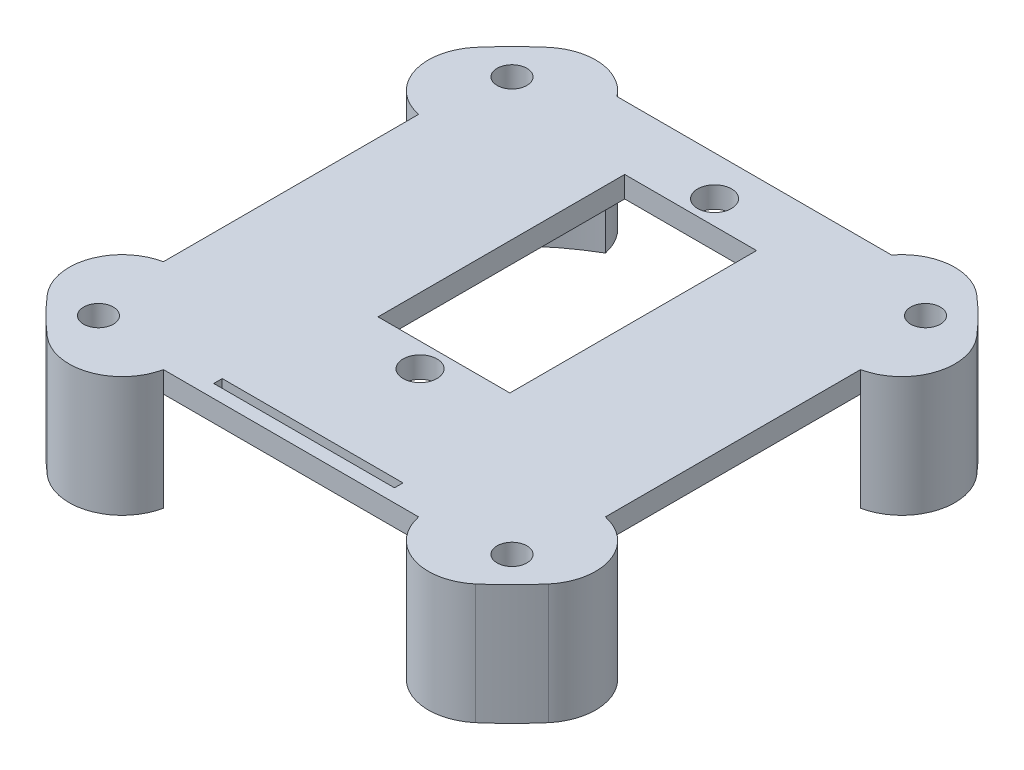
from build123d import *

# Parameters (mm, degrees)
SKETCH3_R            = 31
SKETCH3_R_2          = 1.6
SERVO_MOUNT_DEPTH    = 2
SKETCH4_R            = 31
SKETCH4_R_2          = 24
SPACER_DEPTH         = 9.3
FLEX_CABLE_REACH     = 47.274
SKETCH5_W            = 17
SKETCH5_H            = 0.8
SKETCH7_W            = 24
SKETCH7_H            = 62
CUT_EXTRUDE3_DEPTH   = 45.816180114
SKETCH8_W            = 62
SKETCH8_H            = 24
CUT_EXTRUDE4_DEPTH   = 45.816180114
MOUNTING_HOLES_REACH = 47.274
SKETCH10_R           = 1.4
CUT_EXTRUDE5_REACH   = 46.816
FILLET2_R            = 5


with BuildPart() as part:
    # Sketch3 → Servo mount (new body)
    with BuildSketch(Plane(origin=(0, 0, 0), x_dir=(1, 0, 0), z_dir=(0, 1, 0))):
        with Locations(Location((0, 0, 0), (0, 0, 270))):
            Circle(SKETCH3_R)
        with Locations(Location((0, -8.65, 0), (0, 0, 270))):
            Circle(SKETCH3_R_2, mode=Mode.SUBTRACT)
        with Locations(Location((0, 19.05, 0), (0, 0, 270))):
            Circle(SKETCH3_R_2, mode=Mode.SUBTRACT)
        Polygon((-6.2, 16.1), (-6.2, 2.227105745), (-6.2, -6.4), (-5.7, -6.4), (5.7, -6.4), (6.2, -6.4), (6.2, 2.227105745), (6.2, 16.1), (6.2, 16.8), (5.7, 16.8), (-5.7, 16.8), (-6.2, 16.8), align=None, mode=Mode.SUBTRACT)
    extrude(amount=-SERVO_MOUNT_DEPTH)

    # Sketch4 → Spacer (add)
    with BuildSketch(Plane(origin=(0, -2, 0), x_dir=(-1, 0, 0), z_dir=(0, -1, 0))):
        with Locations(Location((0, 0, 0), (0, 0, 270))):
            Circle(SKETCH4_R)
        with Locations(Location((0, 0, 0), (0, 0, 270))):
            Circle(SKETCH4_R_2, mode=Mode.SUBTRACT)
    extrude(amount=SPACER_DEPTH)

    # Sketch5 → Flex cable (cut, up to next)
    with BuildSketch(Plane(origin=(0, 0, 0), x_dir=(1, 0, 0), z_dir=(0, 1, 0)), mode=Mode.PRIVATE) as flex_cable_sk1:
        with Locations((0, -19.15054858)):
            Rectangle(SKETCH5_W, SKETCH5_H)
    flex_cable_tool1 = extrude(flex_cable_sk1.sketch, amount=-FLEX_CABLE_REACH, mode=Mode.PRIVATE) & part.part
    add(flex_cable_tool1.solids().sort_by_distance((0, 0, 19.150549))[0], mode=Mode.SUBTRACT)

    # Sketch7 → Cut-Extrude3 (cut, through all)
    with BuildSketch(Plane.XZ.offset(2)):
        Rectangle(SKETCH7_W, SKETCH7_H)
    extrude(amount=CUT_EXTRUDE3_DEPTH, mode=Mode.SUBTRACT)

    # Sketch8 → Cut-Extrude4 (cut, through all)
    with BuildSketch(Plane.XZ.offset(2)):
        Rectangle(SKETCH8_W, SKETCH8_H)
    extrude(amount=CUT_EXTRUDE4_DEPTH, mode=Mode.SUBTRACT)

    # Sketch10 → Mounting holes (cut, up to next)
    with BuildSketch(Plane.XZ.offset(11.3), mode=Mode.PRIVATE) as mounting_holes_sk1:
        with Locations(Location((-19.445436483, -19.445436483, 0), (0, 0, 270))):
            Circle(SKETCH10_R)
    mounting_holes_tool1 = extrude(mounting_holes_sk1.sketch, amount=-MOUNTING_HOLES_REACH, mode=Mode.PRIVATE) & part.part
    # Sketch10 → Mounting holes (cut, up to next)
    with BuildSketch(Plane.XZ.offset(11.3), mode=Mode.PRIVATE) as mounting_holes_sk2:
        with Locations(Location((19.445436483, -19.445436483, 0), (0, 0, 270))):
            Circle(SKETCH10_R)
    mounting_holes_tool2 = extrude(mounting_holes_sk2.sketch, amount=-MOUNTING_HOLES_REACH, mode=Mode.PRIVATE) & part.part
    # Sketch10 → Mounting holes (cut, up to next)
    with BuildSketch(Plane.XZ.offset(11.3), mode=Mode.PRIVATE) as mounting_holes_sk3:
        with Locations(Location((-19.445436483, 19.445436483, 0), (0, 0, 270))):
            Circle(SKETCH10_R)
    mounting_holes_tool3 = extrude(mounting_holes_sk3.sketch, amount=-MOUNTING_HOLES_REACH, mode=Mode.PRIVATE) & part.part
    # Sketch10 → Mounting holes (cut, up to next)
    with BuildSketch(Plane.XZ.offset(11.3), mode=Mode.PRIVATE) as mounting_holes_sk4:
        with Locations(Location((19.445436483, 19.445436483, 0), (0, 0, 270))):
            Circle(SKETCH10_R)
    mounting_holes_tool4 = extrude(mounting_holes_sk4.sketch, amount=-MOUNTING_HOLES_REACH, mode=Mode.PRIVATE) & part.part
    add(mounting_holes_tool1.solids().sort_by_distance((-19.445436, -11.3, -19.445436))[0], mode=Mode.SUBTRACT)
    add(mounting_holes_tool2.solids().sort_by_distance((19.445436, -11.3, -19.445436))[0], mode=Mode.SUBTRACT)
    add(mounting_holes_tool3.solids().sort_by_distance((-19.445436, -11.3, 19.445436))[0], mode=Mode.SUBTRACT)
    add(mounting_holes_tool4.solids().sort_by_distance((19.445436, -11.3, 19.445436))[0], mode=Mode.SUBTRACT)

    # Sketch11 → Cut-Extrude5 (cut, up to next)
    with BuildSketch(Plane.XZ.offset(2), mode=Mode.PRIVATE) as cut_extrude5_sk1:
        with BuildLine():
            Line((-12, -22.784609691), (12, -22.784609691))
            Line((12, -22.784609691), (12, -28.583211856))
            ThreePointArc((12, -28.583211856), (0, -31), (-12, -28.583211856))
            Line((-12, -28.583211856), (-12, -22.784609691))
        make_face()
    cut_extrude5_tool1 = extrude(cut_extrude5_sk1.sketch, amount=-CUT_EXTRUDE5_REACH, mode=Mode.PRIVATE) & part.part
    # Sketch11 → Cut-Extrude5 (cut, up to next)
    with BuildSketch(Plane.XZ.offset(2), mode=Mode.PRIVATE) as cut_extrude5_sk2:
        with BuildLine():
            Line((28.583211856, 12), (20.784609691, 12))
            Line((20.784609691, 12), (20.784609691, -12))
            Line((20.784609691, -12), (28.583211856, -12))
            ThreePointArc((28.583211856, -12), (31, 0), (28.583211856, 12))
        make_face()
    cut_extrude5_tool2 = extrude(cut_extrude5_sk2.sketch, amount=-CUT_EXTRUDE5_REACH, mode=Mode.PRIVATE) & part.part
    # Sketch11 → Cut-Extrude5 (cut, up to next)
    with BuildSketch(Plane.XZ.offset(2), mode=Mode.PRIVATE) as cut_extrude5_sk3:
        with BuildLine():
            Line((-28.583211856, -12), (-20.784609691, -12))
            Line((-20.784609691, -12), (-20.784609691, 12))
            Line((-20.784609691, 12), (-28.583211856, 12))
            ThreePointArc((-28.583211856, 12), (-31, 0), (-28.583211856, -12))
        make_face()
    cut_extrude5_tool3 = extrude(cut_extrude5_sk3.sketch, amount=-CUT_EXTRUDE5_REACH, mode=Mode.PRIVATE) & part.part
    # Sketch11 → Cut-Extrude5 (cut, up to next)
    with BuildSketch(Plane.XZ.offset(2), mode=Mode.PRIVATE) as cut_extrude5_sk4:
        with BuildLine():
            Line((12, 20.784609691), (12, 28.583211856))
            ThreePointArc((12, 28.583211856), (0, 31), (-12, 28.583211856))
            Line((-12, 28.583211856), (-12, 20.784609691))
            Line((-12, 20.784609691), (12, 20.784609691))
        make_face()
    cut_extrude5_tool4 = extrude(cut_extrude5_sk4.sketch, amount=-CUT_EXTRUDE5_REACH, mode=Mode.PRIVATE) & part.part
    add(cut_extrude5_tool1.solids().sort_by_distance((0, -2, -26.530561))[0], mode=Mode.SUBTRACT)
    add(cut_extrude5_tool2.solids().sort_by_distance((25.523226, -2, 0))[0], mode=Mode.SUBTRACT)
    add(cut_extrude5_tool3.solids().sort_by_distance((-25.523226, -2, 0))[0], mode=Mode.SUBTRACT)
    add(cut_extrude5_tool4.solids().sort_by_distance((0, -2, 25.523226))[0], mode=Mode.SUBTRACT)

    # Fillet2
    # the kernel refuses this fillet: 5 mm, written as the material it takes off along each edge
    with BuildSketch(Plane(origin=(12, -35.215595033, 28.583211856), x_dir=(0.8512708603213988, -2.9625112876132807e-14, -0.5247265215020731), z_dir=(0, 1, 0))) as fillet2_piece_1:
        with BuildLine():
            CenterArc((8.794767206, 4.940124775), FILLET2_R, 160.140208495, 118.735653745)
            Line((4.092133387, 6.638722774), (0, 0))
            ThreePointArc((0, 0), (4.783119007, -0.371226395), (9.566238013, 0))
        make_face()
    extrude(amount=59.131190067, mode=Mode.SUBTRACT)
    with BuildSketch(Plane(origin=(12, 23.915595033, -28.583211856), x_dir=(0, 0, 1), z_dir=(0, -1, 0))) as fillet2_piece_2_section:
        with BuildLine():
            CenterArc((8.820231871, -4.894514557), FILLET2_R, 101.790043136, 118.735653745)
            ThreePointArc((5.019658797, -8.143459664), (2.193815186, -4.266522167), (0, 0))
            Line((0, 0), (7.798602165, 0))
        make_face()
    fillet2_piece_2 = extrude(amount=59.131190067, mode=Mode.PRIVATE)
    fillet2_piece_2 = split(fillet2_piece_2, bisect_by=Plane(origin=(16.358047436, -1, -22.784609691), z_dir=(0, 0, -1)), keep=Keep.TOP, mode=Mode.PRIVATE)
    add(fillet2_piece_2, mode=Mode.SUBTRACT)
    with BuildSketch(Plane(origin=(12, 23.915595033, -28.583211856), x_dir=(0, 0, 1), z_dir=(0, -1, 0))) as fillet2_piece_3_section:
        with BuildLine():
            CenterArc((8.820231871, -4.894514557), FILLET2_R, 101.790043136, 118.735653745)
            ThreePointArc((5.019658797, -8.143459664), (2.193815186, -4.266522167), (0, 0))
            Line((0, 0), (7.798602165, 0))
        make_face()
    fillet2_piece_3 = extrude(amount=59.131190067, mode=Mode.PRIVATE)
    fillet2_piece_3 = split(fillet2_piece_3, bisect_by=Plane(origin=(12.335072, -2, -21.839415291), z_dir=(0, -1, 0)), keep=Keep.TOP, mode=Mode.PRIVATE)
    add(fillet2_piece_3, mode=Mode.SUBTRACT)
    with BuildSketch(Plane(origin=(28.583211856, 23.915595033, -12), x_dir=(-1, 0, 0), z_dir=(0, -1, 0))) as fillet2_piece_4:
        with BuildLine():
            CenterArc((8.820231871, 4.894514557), FILLET2_R, 139.474303119, 118.735653745)
            ThreePointArc((5.019658797, 8.143459664), (2.193815186, 4.266522167), (0, 0))
            Line((0, 0), (7.798602165, 0))
        make_face()
    extrude(amount=59.131190067, mode=Mode.SUBTRACT)
    with BuildSketch(Plane(origin=(-28.583211856, 23.915595033, -12), x_dir=(1, 0, 0), z_dir=(0, -1, 0)), Plane(origin=(28.583211856, 23.915595033, 12), x_dir=(-1, 0, 0), z_dir=(0, -1, 0))) as fillet2_piece_5:
        with BuildLine():
            CenterArc((8.820231871, -4.894514557), FILLET2_R, 101.790043136, 118.735653745)
            ThreePointArc((5.019658797, -8.143459664), (2.193815186, -4.266522167), (0, 0))
            Line((0, 0), (7.798602165, 0))
        make_face()
    extrude(amount=59.131190067, mode=Mode.SUBTRACT)
    with BuildSketch(Plane(origin=(-28.583211856, 23.915595033, 12), x_dir=(0.5247265215020732, -2.488832337515826e-14, 0.8512708603213986), z_dir=(0, -1, 0)), Plane(origin=(-12, -35.215595033, 28.583211856), x_dir=(-0.8512708603213989, -3.062415803150537e-14, -0.524726521502073), z_dir=(0, 1, 0))) as fillet2_piece_6:
        with BuildLine():
            CenterArc((8.794767206, -4.940124775), FILLET2_R, 81.12413776, 118.735653745)
            Line((4.092133387, -6.638722774), (0, 0))
            ThreePointArc((0, 0), (4.783119007, 0.371226395), (9.566238013, 0))
        make_face()
    extrude(amount=59.131190067, mode=Mode.SUBTRACT)
    with BuildSketch(Plane(origin=(-12, 23.915595033, -28.583211856), x_dir=(-0.8512708603213988, 1.214076701840839e-14, 0.5247265215020731), z_dir=(0, -1, 0))) as fillet2_piece_7_section:
        with BuildLine():
            CenterArc((8.794767206, -4.940124775), FILLET2_R, 81.12413776, 118.735653745)
            Line((4.092133387, -6.638722774), (0, 0))
            ThreePointArc((0, 0), (4.783119007, 0.371226395), (9.566238013, 0))
        make_face()
    fillet2_piece_7 = extrude(amount=59.131190067, mode=Mode.PRIVATE)
    fillet2_piece_7 = split(fillet2_piece_7, bisect_by=Plane(origin=(-16.358047436, -1, -22.784609691), z_dir=(0, 0, -1)), keep=Keep.TOP, mode=Mode.PRIVATE)
    add(fillet2_piece_7, mode=Mode.SUBTRACT)
    with BuildSketch(Plane(origin=(-12, 23.915595033, -28.583211856), x_dir=(-0.8512708603213988, 1.214076701840839e-14, 0.5247265215020731), z_dir=(0, -1, 0))) as fillet2_piece_8_section:
        with BuildLine():
            CenterArc((8.794767206, -4.940124775), FILLET2_R, 81.12413776, 118.735653745)
            Line((4.092133387, -6.638722774), (0, 0))
            ThreePointArc((0, 0), (4.783119007, 0.371226395), (9.566238013, 0))
        make_face()
    fillet2_piece_8 = extrude(amount=59.131190067, mode=Mode.PRIVATE)
    fillet2_piece_8 = split(fillet2_piece_8, bisect_by=Plane(origin=(-12.335072, -2, -21.839415291), z_dir=(0, -1, 0)), keep=Keep.TOP, mode=Mode.PRIVATE)
    add(fillet2_piece_8, mode=Mode.SUBTRACT)


solid = part.part
